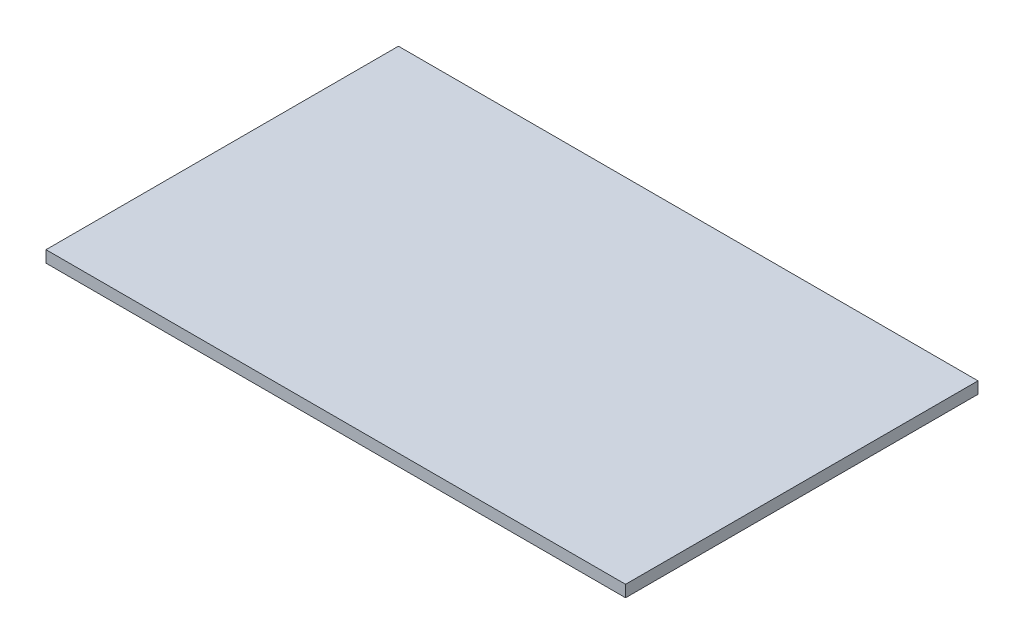
from build123d import *

# Parameters (mm, degrees)
SKETCH1_W           = 125.680146776
SKETCH1_H           = 76.427116282
BOSS_EXTRUDE1_DEPTH = 2.54


with BuildPart() as part:
    # Sketch1 → Boss-Extrude1 (new body)
    with BuildSketch(Plane(origin=(0, 0, 0), x_dir=(1, 0, 0), z_dir=(0, 1, 0))):
        Rectangle(SKETCH1_W, SKETCH1_H)
    extrude(amount=BOSS_EXTRUDE1_DEPTH)


solid = part.part
